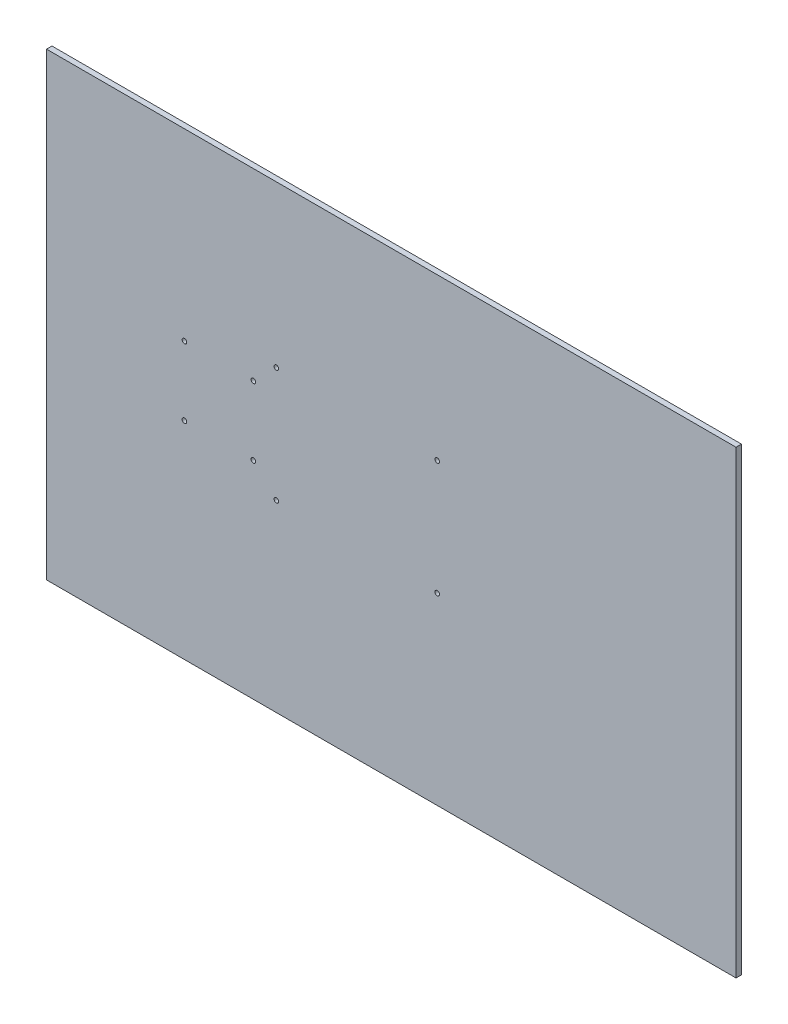
from build123d import *

# Parameters (mm, degrees)
SKETCH2_W           = 762
SKETCH2_H           = 508
SKETCH2_R           = 2.555
BOSS_EXTRUDE1_DEPTH = 6


with BuildPart() as part:
    # Sketch2 → Boss-Extrude1 (new body)
    with BuildSketch(Plane.XY):
        Rectangle(SKETCH2_W, SKETCH2_H)
        with Locations((-228.6, 50.8)):
            Circle(SKETCH2_R, mode=Mode.SUBTRACT)
        with Locations((-228.6, -25.4)):
            Circle(SKETCH2_R, mode=Mode.SUBTRACT)
        with Locations((-152.4, 50.8)):
            Circle(SKETCH2_R, mode=Mode.SUBTRACT)
        with Locations((-152.4, -25.4)):
            Circle(SKETCH2_R, mode=Mode.SUBTRACT)
        with Locations((-127, 76.2)):
            Circle(SKETCH2_R, mode=Mode.SUBTRACT)
        with Locations((-127, -50.8)):
            Circle(SKETCH2_R, mode=Mode.SUBTRACT)
        with Locations((50.8, 76.2)):
            Circle(SKETCH2_R, mode=Mode.SUBTRACT)
        with Locations((50.8, -50.8)):
            Circle(SKETCH2_R, mode=Mode.SUBTRACT)
    extrude(amount=BOSS_EXTRUDE1_DEPTH)


solid = part.part
